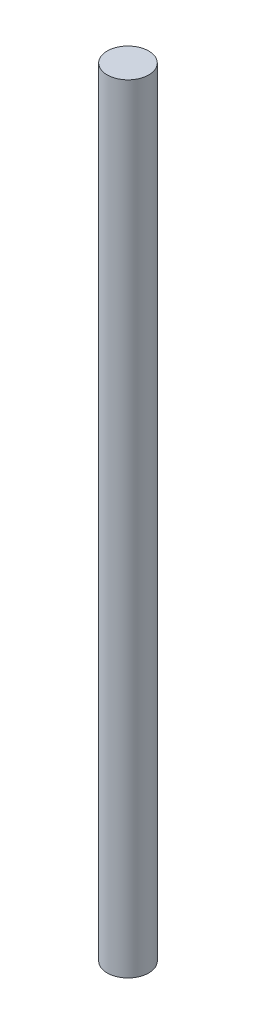
from build123d import *

# Parameters (mm, degrees)
SKETCH1_R  = 4
BASE_DEPTH = 150


with BuildPart() as part:
    # Sketch1 → Base (new body)
    with BuildSketch(Plane(origin=(0, 0, 0), x_dir=(1, 0, 0), z_dir=(0, 1, 0))):
        Circle(SKETCH1_R)
    extrude(amount=BASE_DEPTH)


solid = part.part
